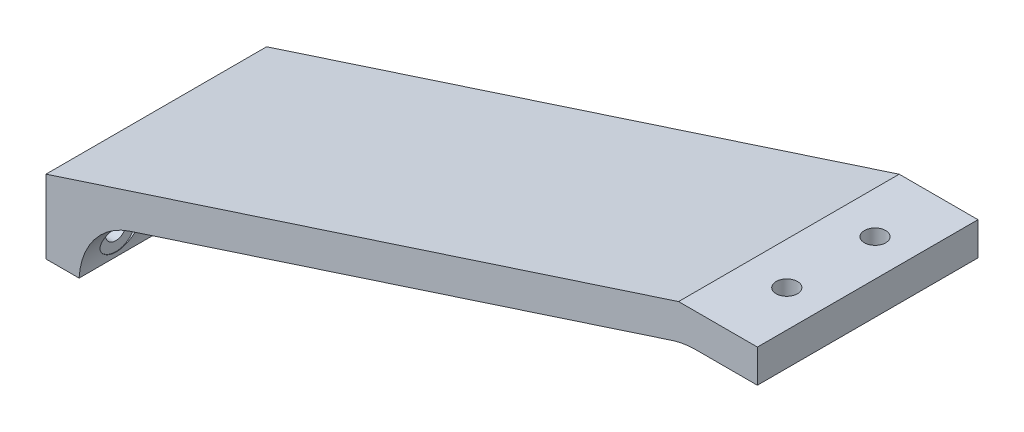
from build123d import *

# Parameters (mm, degrees)
BOSS_EXTRUDE1_DEPTH    = 15
M2_5_CLEARANCE_HOLE1_D = 2.9
M2_5_CLEARANCE_HOLE2_D = 2.9
FILLET1_START          = -15
FILLET1_DEPTH          = 30
FILLET1_START_2        = 4.5
FILLET1_2_OUTLINE_R    = 1.45
FILLET1_2_DEPTH        = 2.5
CUT_EXTRUDE1_START     = -4.5
SKETCH6_R              = 2.75
SKETCH6_R_2            = 2.749999999
CUT_EXTRUDE1_DEPTH     = 10


with BuildPart() as part:
    # Sketch1 → Boss-Extrude1 (new, symmetric)
    with BuildSketch(Plane.XY):
        Polygon((0, 0), (0, -10), (4.5, -10), (4.5, -3.267573076), (86.73, 23.5), (96.73, 23.5), (96.73, 28), (86.016016224, 28), align=None)
    extrude(amount=BOSS_EXTRUDE1_DEPTH, both=True)

    # M2.5 Clearance Hole1 (through all)
    with Locations(Plane(origin=(0, 23.5, 0), x_dir=(-1, 0, 0), z_dir=(0, -1, 0))):
        with Locations((-91.73, -6), (-91.73, 6)):
            Hole(M2_5_CLEARANCE_HOLE1_D / 2)

    # M2.5 Clearance Hole2 (through all)
    with Locations(Plane(origin=(4.5, 0, 0), x_dir=(0, 0, -1), z_dir=(1, 0, 0))):
        with Locations((-10, -6.633786538), (10, -6.633786538)):
            Hole(M2_5_CLEARANCE_HOLE2_D / 2)

    # Fillet1: read off the stored shape, not the designer's step
    # Fillet1 outline → Fillet1 (add)
    with BuildSketch(Plane.XY.offset(FILLET1_START)):
        with BuildLine():
            ThreePointArc((4.5, -10), (6.553657374, -4.444003243), (11.390420445, -1.024598094))
            Line((11.390420445, -1.024598094), (4.5, -3.267573076))
            Line((4.5, -3.267573076), (4.5, -10))
        make_face()
        with BuildLine():
            ThreePointArc((85.221291355, 23.008883997), (86.749601573, 23.376457866), (88.316630614, 23.5))
            Line((88.316630614, 23.5), (86.73, 23.5))
            Line((86.73, 23.5), (85.221291355, 23.008883997))
        make_face()
    extrude(amount=FILLET1_DEPTH)

    # Fillet1 2 outline → Fillet1 2 (cut)
    with BuildSketch(Plane.YZ.offset(FILLET1_START_2)):
        with Locations((-6.633786538, -10)):
            Circle(FILLET1_2_OUTLINE_R)
        with Locations((-6.633786538, 10)):
            Circle(FILLET1_2_OUTLINE_R)
    extrude(amount=FILLET1_2_DEPTH, mode=Mode.SUBTRACT)

    # Sketch6 → Cut-Extrude1 (cut)
    with BuildSketch(Plane.ZY.offset(CUT_EXTRUDE1_START)):
        with Locations(Location((-10, -6.633786538, 0), (0, 0, 270))):
            Circle(SKETCH6_R)
        with Locations(Location((10, -6.633786538, 0), (0, 0, 270))):
            Circle(SKETCH6_R_2)
    extrude(amount=-CUT_EXTRUDE1_DEPTH, mode=Mode.SUBTRACT)


solid = part.part
